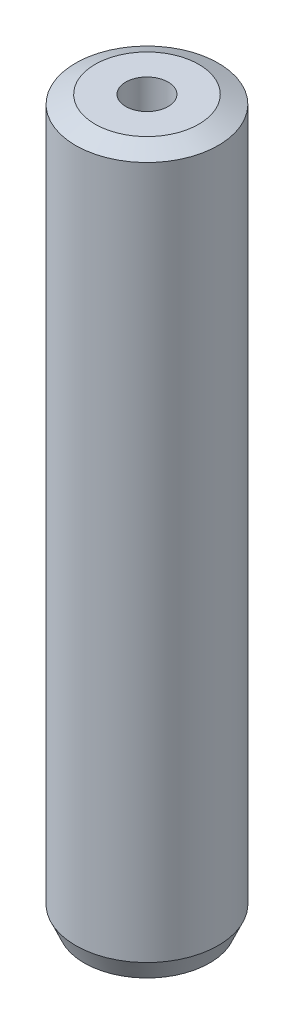
from build123d import *
from OCP.BRepFilletAPI import BRepFilletAPI_MakeChamfer

# Parameters (mm, degrees)
SKETCH1_R           = 42.5
BOSS_EXTRUDE1_DEPTH = 429.365131934
SKETCH2_R           = 12.631409174
CUT_EXTRUDE1_DEPTH  = 434.551515418
CHAMFER1_SIZE       = 5.15344482
CHAMFER1_SIZE2      = 11.616612053


with BuildPart() as part:
    # Sketch1 → Boss-Extrude1 (new body)
    with BuildSketch(Plane(origin=(0, 0, 0), x_dir=(1, 0, 0), z_dir=(0, 1, 0))):
        Circle(SKETCH1_R)
    extrude(amount=BOSS_EXTRUDE1_DEPTH)

    # Sketch2 → Cut-Extrude1 (cut, through all)
    with BuildSketch(Plane(origin=(0, 0, 0), x_dir=(1, 0, 0), z_dir=(0, 1, 0))):
        Circle(SKETCH2_R)
    extrude(amount=CUT_EXTRUDE1_DEPTH, mode=Mode.SUBTRACT)

    # Chamfer1: one chamfer whose edges measure the first distance from different faces: ONE call of the kernel's chamfer builder (chamfer() names one face for all edges)
    chamfer1_edges_1 = [part.edges().sort_by_distance(p)[0] for p in [
        (-42.5, 429.365131934, 0),
    ]]
    chamfer1_side_1 = [part.faces().sort_by_distance(p)[0] for p in [
        (-42.5, 214.682565967, 0),
    ]]
    chamfer1_edges_2 = [part.edges().sort_by_distance(p)[0] for p in [
        (-42.5, 0, 0),
    ]]
    chamfer1_side_2 = [part.faces().sort_by_distance(p)[0] for p in [
        (-41.297918472, 0, 0),
    ]]
    chamfer1 = BRepFilletAPI_MakeChamfer(part.part.solid().wrapped)
    for e in chamfer1_edges_1:
        chamfer1.Add(CHAMFER1_SIZE, CHAMFER1_SIZE2, e.wrapped, chamfer1_side_1[0].wrapped)  # the first distance lies on this face
    for e in chamfer1_edges_2:
        chamfer1.Add(CHAMFER1_SIZE, CHAMFER1_SIZE2, e.wrapped, chamfer1_side_2[0].wrapped)  # the first distance lies on this face
    add(Compound.cast(chamfer1.Shape()), mode=Mode.REPLACE)


solid = part.part
